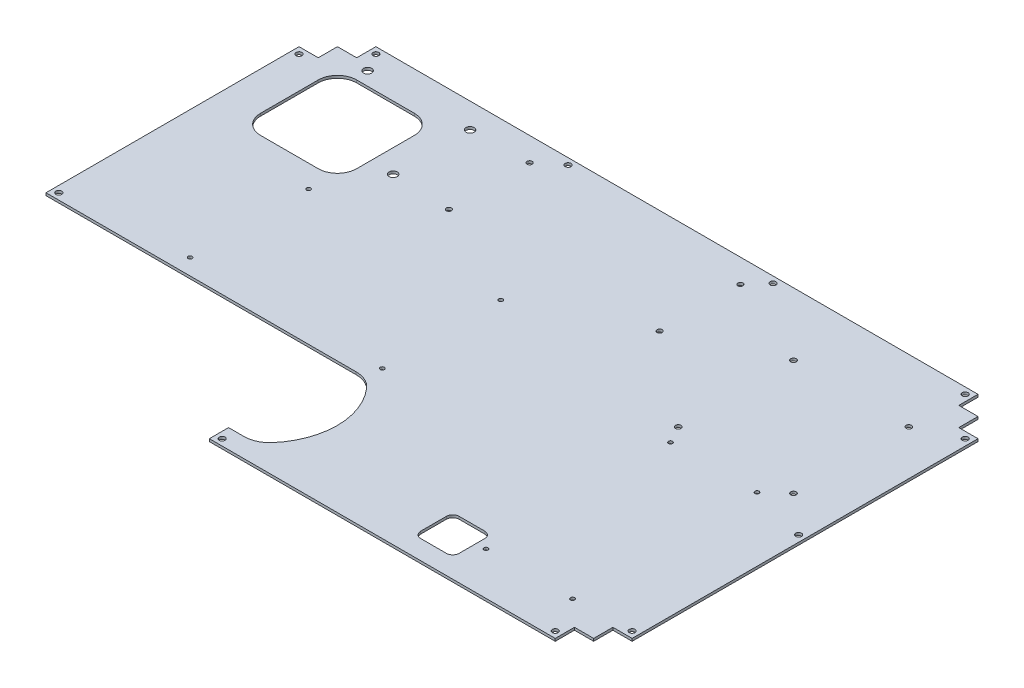
from build123d import *

# Parameters (mm, degrees)
BASE_FLANGE1_DEPTH   = 2
CUT_EXTRUDE1_REACH   = 314.176
CUT_EXTRUDE2_REACH   = 314.176
CUT_EXTRUDE3_REACH   = 314.176
M4_CLEARANCE_HOLE1_D = 4.5
CUT_EXTRUDE4_REACH   = 314.176
SKETCH7_R            = 2
M3_CLEARANCE_HOLE1_D = 3.2
M6_CLEARANCE_HOLE1_D = 6.4
M4_CLEARANCE_HOLE2_D = 4.3


# Sheet-metal steps are written as plain solids
with BuildPart() as part:
    # Sketch1 → Base-Flange1 (new body)
    with BuildSketch(Plane(origin=(0, 0, 0), x_dir=(1, 0, 0), z_dir=(0, 1, 0))):
        Polygon((-250, -150), (-235, -150), (-235, -165), (235, -165), (235, -150), (250, -150), (250, -135), (265, -135), (265, 135), (250, 135), (250, 150), (235, 150), (235, 165), (-235, 165), (-235, 150), (-250, 150), (-250, 135), (-265, 135), (-265, -135), (-250, -135), align=None)
    extrude(amount=-BASE_FLANGE1_DEPTH)

    # Sketch2 → Cut-Extrude1 (cut, up to next)
    with BuildSketch(Plane(origin=(0, 0, 0), x_dir=(1, 0, 0), z_dir=(0, 1, 0)), mode=Mode.PRIVATE) as cut_extrude1_sk1:
        with BuildLine():
            Line((-265, -62.5), (-22.909290949, -62.5))
            ThreePointArc((-22.909290949, -62.5), (-14.653646014, -64.283405184), (-7.870317076, -69.315567329))
            ThreePointArc((-7.870317076, -69.315567329), (6.027337078, -106.25), (-7.870317076, -143.184432671))
            ThreePointArc((-7.870317076, -143.184432671), (-14.653646014, -148.216594816), (-22.909290949, -150))
            Line((-22.909290949, -150), (-35, -150))
            Line((-35, -150), (-35, -165))
            Line((-35, -165), (-265, -165))
            Line((-265, -165), (-265, -62.5))
        make_face()
    cut_extrude1_tool1 = extrude(cut_extrude1_sk1.sketch, amount=-CUT_EXTRUDE1_REACH, mode=Mode.PRIVATE) & part.part
    add(cut_extrude1_tool1.solids().sort_by_distance((-134.940793, 0, 112.899741))[0], mode=Mode.SUBTRACT)

    # Sketch3 → Cut-Extrude2 (cut, up to next)
    with BuildSketch(Plane(origin=(0, 0, 0), x_dir=(1, 0, 0), z_dir=(0, 1, 0)), mode=Mode.PRIVATE) as cut_extrude2_sk1:
        with BuildLine():
            Line((-220, 135), (-175, 135))
            ThreePointArc((-175, 135), (-164.393398282, 130.606601718), (-160, 120))
            Line((-160, 120), (-160, 75))
            ThreePointArc((-160, 75), (-164.393398282, 64.393398282), (-175, 60))
            Line((-175, 60), (-220, 60))
            ThreePointArc((-220, 60), (-230.606601718, 64.393398282), (-235, 75))
            Line((-235, 75), (-235, 120))
            ThreePointArc((-235, 120), (-230.606601718, 130.606601718), (-220, 135))
        make_face()
    cut_extrude2_tool1 = extrude(cut_extrude2_sk1.sketch, amount=-CUT_EXTRUDE2_REACH, mode=Mode.PRIVATE) & part.part
    add(cut_extrude2_tool1.solids().sort_by_distance((-197.5, 0, -97.5))[0], mode=Mode.SUBTRACT)

    # Sketch4 → Cut-Extrude3 (cut, up to next)
    with BuildSketch(Plane(origin=(0, 0, 0), x_dir=(1, 0, 0), z_dir=(0, 1, 0)), mode=Mode.PRIVATE) as cut_extrude3_sk1:
        with BuildLine():
            Line((115, -120), (135, -120))
            ThreePointArc((135, -120), (138.535533906, -121.464466094), (140, -125))
            Line((140, -125), (140, -145))
            ThreePointArc((140, -145), (138.535533906, -148.535533906), (135, -150))
            Line((135, -150), (115, -150))
            ThreePointArc((115, -150), (111.464466094, -148.535533906), (110, -145))
            Line((110, -145), (110, -125))
            ThreePointArc((110, -125), (111.464466094, -121.464466094), (115, -120))
        make_face()
    cut_extrude3_tool1 = extrude(cut_extrude3_sk1.sketch, amount=-CUT_EXTRUDE3_REACH, mode=Mode.PRIVATE) & part.part
    add(cut_extrude3_tool1.solids().sort_by_distance((125, 0, 135))[0], mode=Mode.SUBTRACT)

    # M4 Clearance Hole1 (through all)
    with Locations(Plane(origin=(0, 0, 0), x_dir=(1, 0, 0), z_dir=(0, 1, 0))):
        with Locations((-230, 160), (-80, 160), (80, 160), (230, 160), (260, 130), (260, 0), (260, -130), (230, -160), (-30, -160), (-260, 130), (-260, -57.5)):
            Hole(M4_CLEARANCE_HOLE1_D / 2)

    # Sketch7 → Cut-Extrude4 (cut, up to next)
    with BuildSketch(Plane(origin=(0, 0, 0), x_dir=(1, 0, 0), z_dir=(0, 1, 0)), mode=Mode.PRIVATE) as cut_extrude4_sk1:
        with Locations(Location((-96.5, 146.5, 0), (0, 0, 270))):
            Circle(SKETCH7_R)
    cut_extrude4_tool1 = extrude(cut_extrude4_sk1.sketch, amount=-CUT_EXTRUDE4_REACH, mode=Mode.PRIVATE) & part.part
    # Sketch7 → Cut-Extrude4 (cut, up to next)
    with BuildSketch(Plane(origin=(0, 0, 0), x_dir=(1, 0, 0), z_dir=(0, 1, 0)), mode=Mode.PRIVATE) as cut_extrude4_sk2:
        with Locations(Location((-96.5, 83.5, 0), (0, 0, 270))):
            Circle(SKETCH7_R)
    cut_extrude4_tool2 = extrude(cut_extrude4_sk2.sketch, amount=-CUT_EXTRUDE4_REACH, mode=Mode.PRIVATE) & part.part
    # Sketch7 → Cut-Extrude4 (cut, up to next)
    with BuildSketch(Plane(origin=(0, 0, 0), x_dir=(1, 0, 0), z_dir=(0, 1, 0)), mode=Mode.PRIVATE) as cut_extrude4_sk3:
        with Locations(Location((68, 83.5, 0), (0, 0, 270))):
            Circle(SKETCH7_R)
    cut_extrude4_tool3 = extrude(cut_extrude4_sk3.sketch, amount=-CUT_EXTRUDE4_REACH, mode=Mode.PRIVATE) & part.part
    # Sketch7 → Cut-Extrude4 (cut, up to next)
    with BuildSketch(Plane(origin=(0, 0, 0), x_dir=(1, 0, 0), z_dir=(0, 1, 0)), mode=Mode.PRIVATE) as cut_extrude4_sk4:
        with Locations(Location((68, 146.5, 0), (0, 0, 270))):
            Circle(SKETCH7_R)
    cut_extrude4_tool4 = extrude(cut_extrude4_sk4.sketch, amount=-CUT_EXTRUDE4_REACH, mode=Mode.PRIVATE) & part.part
    add(cut_extrude4_tool1.solids().sort_by_distance((-96.5, 0, -146.5))[0], mode=Mode.SUBTRACT)
    add(cut_extrude4_tool2.solids().sort_by_distance((-96.5, 0, -83.5))[0], mode=Mode.SUBTRACT)
    add(cut_extrude4_tool3.solids().sort_by_distance((68, 0, -83.5))[0], mode=Mode.SUBTRACT)
    add(cut_extrude4_tool4.solids().sort_by_distance((68, 0, -146.5))[0], mode=Mode.SUBTRACT)

    # M3 Clearance Hole1 (through all)
    with Locations(Plane(origin=(0, 0, 0), x_dir=(1, 0, 0), z_dir=(0, 1, 0))):
        with Locations((147.5, 12.5), (215, -131.5), (147.5, -131.5), (215, 12.5), (-15, -50), (-165, 42.5), (-15, 42.5), (-165, -50)):
            Hole(M3_CLEARANCE_HOLE1_D / 2)

    # M6 Clearance Hole1 (through all)
    with Locations(Plane(origin=(0, 0, 0), x_dir=(1, 0, 0), z_dir=(0, 1, 0))):
        with Locations((-142, 145.5), (-222, 145.5), (-142, 85.5)):
            Hole(M6_CLEARANCE_HOLE1_D / 2)

    # M4 Clearance Hole2 (through all)
    with Locations(Plane(origin=(0, 0, 0), x_dir=(1, 0, 0), z_dir=(0, 1, 0))):
        with Locations((230, 116), (140, 26), (230, 26), (140, 116)):
            Hole(M4_CLEARANCE_HOLE2_D / 2)


solid = part.part
